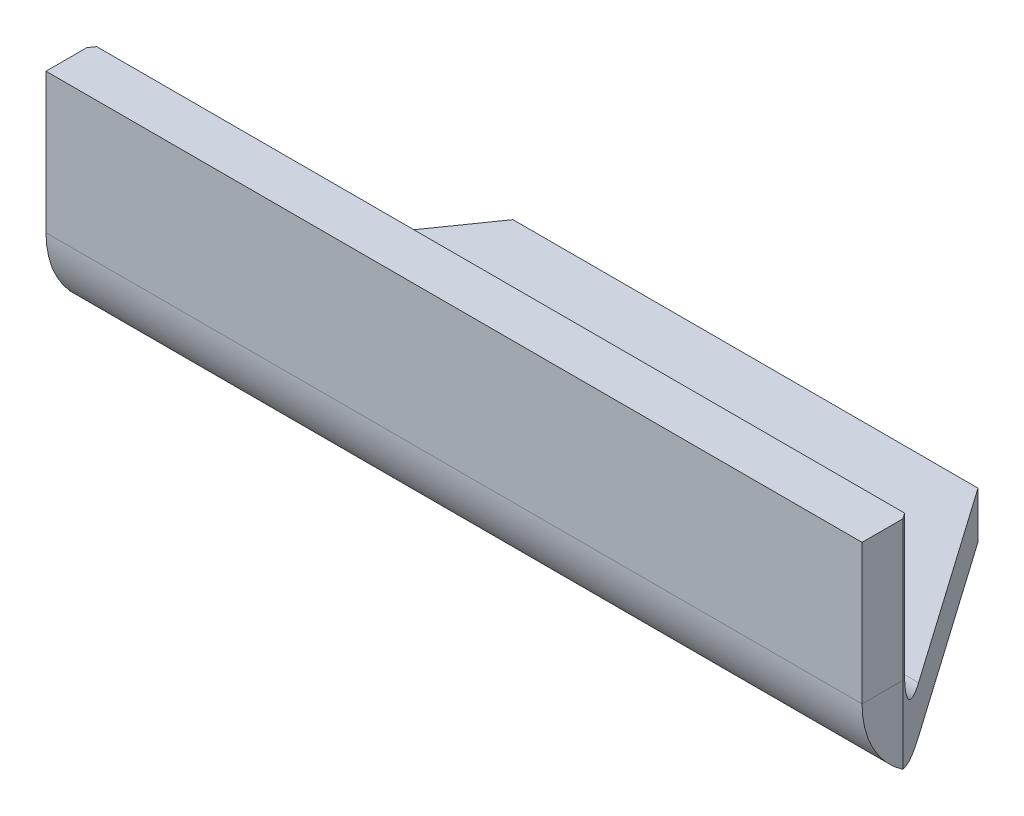
from build123d import *

# Parameters (mm, degrees)
SKETCH1_W                    = 140
SKETCH1_H                    = 50
BASE_FLANGE1_DEPTH           = 8
EDGE_FLANGE1_STRIP_W         = 48
EDGE_FLANGE1_STRIP_H         = 8
EDGE_FLANGE1_STRIP_CUT_DEPTH = 140
EDGE_FLANGE1_DEPTH           = 140
CHAMFER1_SIZE                = 43
CHAMFER1_SIZE2               = 30.108924143
MIRROR2_START                = 47.016267246
MIRROR2_OUTLINE_W            = 55
MIRROR2_OUTLINE_H            = 41
MIRROR2_DEPTH                = 24.663786763


# Read off the part's stored shape, not the designer's step: Mirror2
# Sheet-metal steps are written as plain solids
with BuildPart() as part:
    # Sketch1 → Base-Flange1 (new body)
    with BuildSketch(Plane(origin=(0, 0, 0), x_dir=(1, 0, 0), z_dir=(0, 1, 0))):
        Rectangle(SKETCH1_W, SKETCH1_H)
    extrude(amount=-BASE_FLANGE1_DEPTH)

    # Edge-Flange1 strip (across the edge) → Edge-Flange1 strip cut (cut)
    with BuildSketch(Plane(origin=(-70, 0, 25), x_dir=(0, 0, -1), z_dir=(1, 0, 0))):
        with Locations((-8, -4)):
            Rectangle(EDGE_FLANGE1_STRIP_W, EDGE_FLANGE1_STRIP_H)
    extrude(amount=EDGE_FLANGE1_STRIP_CUT_DEPTH, mode=Mode.SUBTRACT)

    # Edge-Flange1 section (across the edge) → Edge-Flange1 (add)
    with BuildSketch(Plane(origin=(-70, 0, 25), x_dir=(0, 0, -1), z_dir=(1, 0, 0))):
        with BuildLine():
            Line((0, 8), (0, 32))
            Line((0, 32), (8, 32))
            Line((8, 32), (8, 8))
            ThreePointArc((8, 8), (10.343145751, 2.343145751), (16, 0))
            Line((16, 0), (16, -8))
            ThreePointArc((16, -8), (4.686291501, -3.313708499), (0, 8))
        make_face()
    extrude(amount=EDGE_FLANGE1_DEPTH)

    # Chamfer1
    chamfer1_edges = [part.edges().sort_by_distance(p)[0] for p in [
        (-70, -4, -25),
    ]]
    chamfer1_side = [part.faces().sort_by_distance(p)[0] for p in [
        (-70, -0.640312424, -8),
    ]]
    chamfer(chamfer1_edges, length=CHAMFER1_SIZE, length2=CHAMFER1_SIZE2, reference=chamfer1_side[0])

    # Mirror2 outline → Mirror2 (cut)
    with BuildSketch(Plane(origin=(0, 0, 0), x_dir=(0.5735764363510512, 0, 0.8191520442889882), z_dir=(0.8191520442889882, 0, -0.5735764363510512)).offset(MIRROR2_START)):
        with Locations((28.5, -12.5)):
            Rectangle(MIRROR2_OUTLINE_W, MIRROR2_OUTLINE_H)
    extrude(amount=MIRROR2_DEPTH, mode=Mode.SUBTRACT)


solid = part.part
